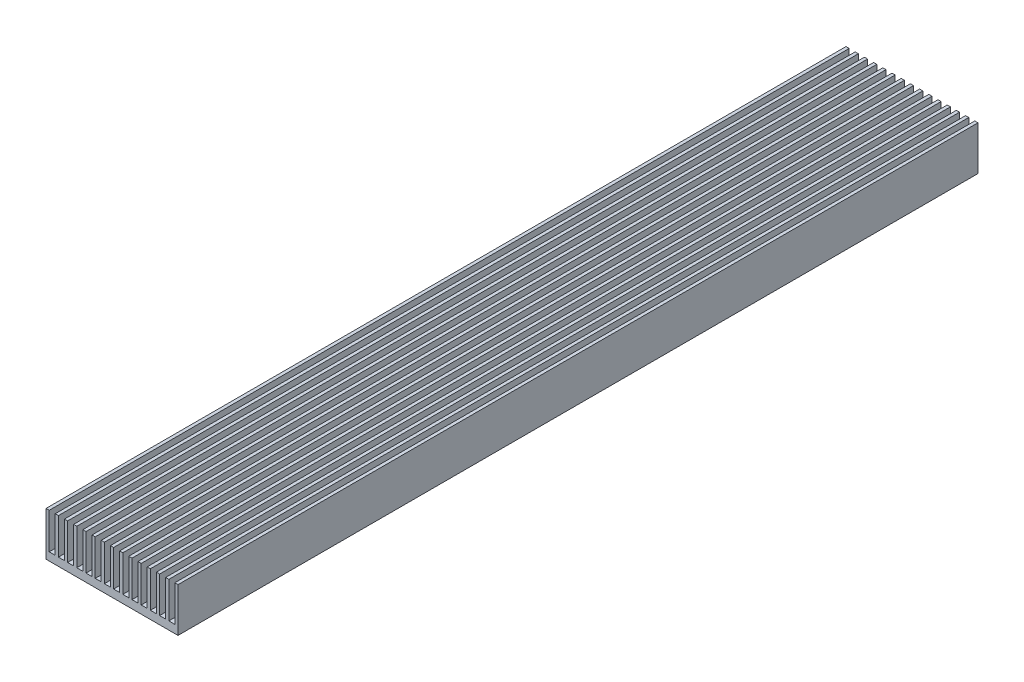
from build123d import *

# Parameters (mm, degrees)
BOSS_EXTRUDE1_DEPTH = 1000


with BuildPart() as part:
    # Sketch1 → Boss-Extrude1 (new body)
    with BuildSketch(Plane.XY):
        Polygon((11.5, 55), (11.5, 10), (4, 10), (4, 55), (0, 55), (0, 10), (0, 0), (165, 0), (165, 10), (165, 55), (161, 55), (161, 10), (153.5, 10), (153.5, 55), (149.5, 55), (149.5, 10), (142, 10), (142, 55), (138, 55), (138, 10), (130.5, 10), (130.5, 55), (126.5, 55), (126.5, 10), (119, 10), (119, 55), (115, 55), (115, 10), (107.5, 10), (107.5, 55), (103.5, 55), (103.5, 10), (96, 10), (96, 55), (92, 55), (92, 10), (84.5, 10), (84.5, 55), (80.5, 55), (80.5, 10), (73, 10), (73, 55), (69, 55), (69, 10), (61.5, 10), (61.5, 55), (57.5, 55), (57.5, 10), (50, 10), (50, 55), (46, 55), (46, 10), (38.5, 10), (38.5, 55), (34.5, 55), (34.5, 10), (27, 10), (27, 55), (23, 55), (23, 10), (15.5, 10), (15.5, 55), align=None)
    extrude(amount=BOSS_EXTRUDE1_DEPTH)


solid = part.part
